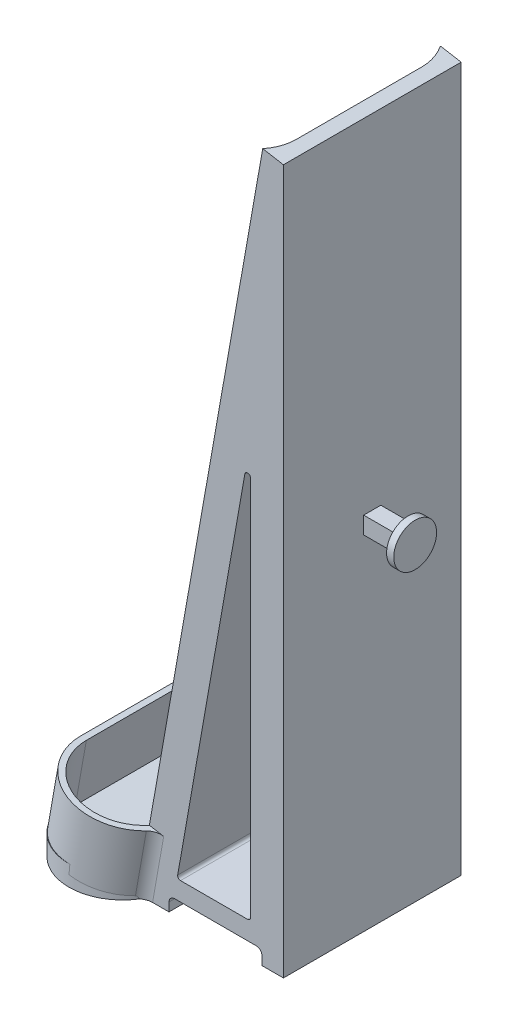
from build123d import *

# Parameters (mm, degrees)
BOSS_EXTRUDE1_DEPTH   = 3.175
BOSS_EXTRUDE2_START   = -3.175
BOSS_EXTRUDE2_DEPTH   = 11.112499999999999
BODY_MOVE_COPY2_ANGLE = 90.0000000000002
BOSS_EXTRUDE5_START   = -3.175
BOSS_EXTRUDE5_DEPTH   = 127
BOSS_EXTRUDE7_DEPTH   = 3.622257574
CUT_EXTRUDE1_START    = -11.112499999999999
CUT_EXTRUDE1_DEPTH    = 11.112499999999999
CUT_EXTRUDE4_REACH    = 131.332
LOFT1_START           = -15.77975
LOFT1_DEPTH           = 31.5595
CUT_EXTRUDE5_DEPTH    = 1.27
CUT_EXTRUDE6_DEPTH    = 133.79321580314624
FILLET2_R             = 0.508
CUT_EXTRUDE7_DEPTH    = 133.79321580314624
FILLET3_R             = 2.54
BOSS_EXTRUDE9_DEPTH   = 7.619999999999999
SKETCH20_R            = 3.81
BOSS_EXTRUDE10_DEPTH  = 1.27


with BuildPart() as part:
    # Sketch4 → Boss-Extrude1 (new body)
    with BuildSketch(Plane(origin=(0, 0, 0), x_dir=(0.984807753012208, -0.17364817766693072, 0), z_dir=(0.17364817766693072, 0.984807753012208, 0))):
        with BuildLine():
            Line((0, -8.731249999999998), (-22.225, -8.731249999999998))
            ThreePointArc((-22.225, -8.731249999999998), (-30.956249999999997, -1.63e-15), (-22.225000000000005, 8.73124999999999))
            Line((-22.225000000000005, 8.73124999999999), (1.71e-15, 8.73125))
            ThreePointArc((1.71e-15, 8.73125), (8.731249999999998, 0), (0, -8.731249999999998))
        make_face()
    extrude(amount=BOSS_EXTRUDE1_DEPTH)

    # Sketch5 → Boss-Extrude2 (add)
    with BuildSketch(Plane(origin=(0.5513329640925053, 3.1267646158137623, 0), x_dir=(0.9848077530122081, -0.17364817766693072, 0), z_dir=(0.17364817766693072, 0.9848077530122081, 0)).offset(BOSS_EXTRUDE2_START)):
        with BuildLine():
            Line((1.57e-15, 9.74725), (-22.225000000000005, 9.74724999999999))
            ThreePointArc((-22.225000000000005, 9.74724999999999), (-31.97225, -1.51e-15), (-22.225, -9.747249999999998))
            Line((-22.225, -9.747249999999998), (1.79e-15, -9.74725))
            ThreePointArc((1.79e-15, -9.74725), (9.74725, 2.16e-15), (1.57e-15, 9.74725))
        make_face()
        with BuildLine():
            Line((5.3e-16, 8.73125), (-22.225000000000005, 8.73124999999999))
            ThreePointArc((-22.225000000000005, 8.73124999999999), (-30.956249999999997, -1.63e-15), (-22.225000000000005, -8.731249999999998))
            Line((-22.225000000000005, -8.731249999999998), (-1.6e-15, -8.73125))
            ThreePointArc((-1.6e-15, -8.73125), (8.73125, -1.94e-15), (5.3e-16, 8.73125))
        make_face(mode=Mode.SUBTRACT)
    extrude(amount=BOSS_EXTRUDE2_DEPTH)


with BuildPart() as part_1:
    # Body-Move/Copy2: moved
    add(part.part.moved(Location((5e-17, 2.8e-16, 0))).rotate(Axis((-10.943676155348163, 1.9296653743237675, 1.73e-15), (0.1736481776669307, 0.984807753012208, 0)), BODY_MOVE_COPY2_ANGLE))

    # Sketch6 → Boss-Extrude5 (add)
    with BuildSketch(Plane(origin=(0.5513329640925054, 3.1267646158137636, -9e-17), x_dir=(0.9848077530122081, -0.1736481776669307, 0), z_dir=(0.1736481776669307, 0.9848077530122081, 0)).offset(BOSS_EXTRUDE5_START)):
        with BuildLine():
            Line((4.4e-16, 15.779750000000002), (-2.5553006918151486, 15.779750000000002))
            ThreePointArc((-2.5553006918151517, 15.77975), (-1.6674472336253352, 13.520790016359634), (-1.3652500000000423, 11.112500000000036))
            Line((-1.3652500000000418, 11.112500000000034), (-1.3652499999999672, -11.11250000000001))
            ThreePointArc((-1.3652499999999694, -11.112500000000013), (-1.667447233625257, -13.520790016359623), (-2.5553006918150736, -15.77975))
            Line((-2.555300691815072, -15.779750000000002), (4.49e-15, -15.779750000000002))
            Line((-1.1e-16, -15.77975), (-1.1e-16, 15.779750000000002))
        make_face()
        with BuildLine():
            ThreePointArc((-1.3652500000000423, 11.112500000000036), (-1.6674472336253352, 13.520790016359634), (-2.5553006918151517, 15.77975))
            Line((-2.5553006918151486, 15.779750000000002), (-3.733373764462396, 15.779750000000002))
            ThreePointArc((-3.7333737644623968, 15.77975), (-2.7260906817477455, 13.54208130327656), (-2.381250000000044, 11.11250000000003))
            Line((-2.3812500000000436, 11.112500000000027), (-2.381249999999966, -11.112499999999974))
            ThreePointArc((-2.3812499999999677, -11.112499999999974), (-2.7260906817476602, -13.542081303276534), (-3.7333737644623177, -15.779750000000003))
            Line((-3.7333737644623204, -15.779750000000002), (-2.555300691815072, -15.779750000000002))
            ThreePointArc((-2.5553006918150736, -15.77975), (-1.667447233625257, -13.520790016359623), (-1.3652499999999694, -11.112500000000013))
            Line((-1.3652499999999672, -11.11250000000001), (-1.3652500000000418, 11.112500000000034))
        make_face()
    extrude(amount=BOSS_EXTRUDE5_DEPTH)


with BuildPart() as boss_extrude7_tool:
    # Boss-Extrude7: read off the stored shape, not the designer's step
    # Boss-Extrude7 outline → Boss-Extrude7 (new body)
    with BuildSketch(Plane(origin=(0, 0, 0), x_dir=(1, 0, 0), z_dir=(0, 1, 0))):
        with BuildLine():
            Line((22.053318564, 15.77975), (-2.516479933, 15.77975))
            add(Edge.make_bspline(
                [(-2.516479933, 15.77975), (-6.087914144025663, 22.428833371813603), (-13.315378834961066, 20.557552766374705), (-20.54284352589647, 18.686272160935808), (-20.542843526, 11.1125)],
                knots=[2.070114834496927, 2.070114834496927, 2.070114834496927, 3.3912519074408096, 3.3912519074408096, 4.712388980384692, 4.712388980384692, 4.712388980384692], degree=2, weights=[1, 0.7896435245481747, 1, 0.7896435245481747, 1]))
            Line((-20.542843526, 11.1125), (-20.542843526, -11.1125))
            add(Edge.make_bspline(
                [(-20.542843526, -11.1125), (-20.542843525896345, -18.68627216093585), (-13.315378834960956, -20.557552766374716), (-6.08791414402557, -22.428833371813585), (-2.516479933, -15.77975)],
                knots=[4.712388980384692, 4.712388980384692, 4.712388980384692, 6.033526053328573, 6.033526053328573, 7.354663126272453, 7.354663126272453, 7.354663126272453], degree=2, weights=[1, 0.7896435245481753, 1, 0.7896435245481753, 1]))
            Line((-2.516479933, -15.77975), (22.053318564, -15.77975))
            Line((22.053318564, -15.77975), (22.053318564, 15.77975))
        make_face()
    extrude(amount=BOSS_EXTRUDE7_DEPTH)


with BuildPart() as part_2:
    add(part_1.part)


with BuildPart() as part_3:
    # Boss-Extrude7: joined with boss_extrude7_tool
    add(part_2.part.fuse(boss_extrude7_tool.part, tol=0.00001))

    # Sketch8 → Cut-Extrude1 (cut)
    with BuildSketch(Plane(origin=(1.929665374323769, 10.943676155348173, 0), x_dir=(0.9848077530122081, -0.17364817766693075, 0), z_dir=(0.17364817766693075, 0.9848077530122081, 0)).offset(CUT_EXTRUDE1_START)):
        with BuildLine():
            ThreePointArc((-3.7333737644623213, -15.779750000000003), (-3.2397646593705955, -14.88804828056871), (-2.853430222713813, -13.944900567790237))
            Line((-2.8534302227138113, -13.944900567790235), (-2.853430222713809, 13.94490056779))
            ThreePointArc((-2.8534302227138095, 13.94490056779), (-3.2397646593706177, 14.888048280568597), (-3.7333737644623985, 15.779750000000003))
            ThreePointArc((-3.7333737644623985, 15.779750000000003), (-13.542081303276605, 19.498909318252295), (-19.843750000000043, 11.112499999999972))
            Line((-19.843750000000046, 11.112499999999972), (-19.843749999999957, -11.112500000000043))
            ThreePointArc((-19.843749999999957, -11.112500000000042), (-13.54208130327649, -19.498909318252302), (-3.7333737644623213, -15.779750000000003))
        make_face()
    extrude(amount=CUT_EXTRUDE1_DEPTH, mode=Mode.SUBTRACT)

    # Sketch9 → Cut-Extrude4 (cut, up to next)
    with BuildSketch(Plane(origin=(0, 0, 0), x_dir=(0.9848077530122081, -0.17364817766693072, 0), z_dir=(0.17364817766693072, 0.9848077530122081, 0)), mode=Mode.PRIVATE) as cut_extrude4_sk1:
        with BuildLine():
            Line((-2.3812500000174737, -11.112499999999976), (-2.3812500000295542, 11.112500000000031))
            ThreePointArc((-2.3812500000295542, 11.112500000000031), (-2.500104004853256, 12.54824433126907), (-2.853430222713811, 13.944900567789999))
            Line((-2.853430222713811, 13.944900567789999), (-2.8534302227138113, -13.944900567790238))
            ThreePointArc((-2.8534302227138113, -13.944900567790238), (-2.500104004825662, -12.548244331273757), (-2.3812500000174737, -11.112499999999976))
        make_face()
    cut_extrude4_tool1 = extrude(cut_extrude4_sk1.sketch, amount=CUT_EXTRUDE4_REACH, mode=Mode.PRIVATE) & part_3.part
    add(cut_extrude4_tool1.solids().sort_by_distance((-2.584299, 0.455682, 0))[0], mode=Mode.SUBTRACT)

    # Loft1: read off the stored shape, not the designer's step
    # Loft1 outline → Loft1 (add)
    with BuildSketch(Plane.XY.offset(LOFT1_START)):
        Polygon((0.638701741, 3.622257574), (22.053318564, 3.622257574), (22.053318564, 125.070584633), align=None)
    extrude(amount=LOFT1_DEPTH)

    # Sketch12 → Cut-Extrude5 (cut)
    with BuildSketch(Plane(origin=(-2.345073461860326, 0.4134997230693797, 8.13e-15), x_dir=(3.36e-15, -5.9e-16, 1), z_dir=(-0.9848077530122081, 0.17364817766693072, 3.4134285390241548e-15))):
        Polygon((-4.240460714922467, 114.34300132888832), (-2.4689363790337167, 114.34300132888832), (-2.4689363790337167, 100.60010241642621), (4.856262408628966, 100.60010241642621), (4.856262408628966, 99.04050890599655), (-4.240460714922467, 99.04050890599655), align=None)
    extrude(amount=-CUT_EXTRUDE5_DEPTH, mode=Mode.SUBTRACT)

    # Sketch13 → Cut-Extrude6 (cut, through all)
    with BuildSketch(Plane(origin=(-8e-17, -4.3e-16, -15.779750000000002), x_dir=(-1, 0, 0), z_dir=(0, -3e-17, -1))):
        Polygon((-5.020709493215531, 16.330763945263843), (-3.171257415384888, 5.842), (-4.367504164096216, 5.842), (-16.211318563640102, 5.842), (-16.211318563640102, 79.79586171686451), align=None)
    extrude(amount=-CUT_EXTRUDE6_DEPTH, mode=Mode.SUBTRACT)

    # Fillet2
    fillet2_edges = [part_3.edges().sort_by_distance(p)[0] for p in [
        (3.171257415384888, 5.842, -1.78e-15),
        (16.211318563640102, 5.842, -1.78e-15),
        (16.211318563640102, 79.79586171686451, -1.78e-15),
    ]]
    fillet(fillet2_edges, radius=FILLET2_R)

    # Sketch15 → Cut-Extrude7 (cut, through all)
    with BuildSketch(Plane.XY.offset(15.779750000000002)):
        with BuildLine():
            Line((18.243318563640102, -4.3e-16), (1.733318563640101, -2.45e-15))
            Line((1.733318563640101, -2.45e-15), (1.733318563640101, 1.5239999999999905))
            ThreePointArc((1.733318563640101, 1.5239999999999905), (2.0308980739545683, 2.24242048968553), (2.7493185636401076, 2.5399999999999974))
            Line((2.7493185636401076, 2.5399999999999974), (17.227318563640093, 2.5399999999999996))
            ThreePointArc((17.227318563640093, 2.5399999999999996), (17.945739053325635, 2.242420489685533), (18.243318563640102, 1.5239999999999927))
            Line((18.243318563640102, 1.5239999999999927), (18.243318563640102, -4.3e-16))
        make_face()
    extrude(amount=-CUT_EXTRUDE7_DEPTH, mode=Mode.SUBTRACT)

    # Fillet3
    fillet3_edges = [part_3.edges().sort_by_distance(p)[0] for p in [
        (-1.5516472454151984, 5.915561386198842, -15.779750000000057),
        (-1.5516472454151131, 5.915561386198828, 15.779750000000059),
    ]]
    fillet(fillet3_edges, radius=FILLET3_R)

    # Sketch18 → Boss-Extrude9 (add)
    with BuildSketch(Plane(origin=(22.0533185636401, 0, 0), x_dir=(0, 0, -1), z_dir=(1, 0, 0))):
        Polygon((-1.5240000000000167, 64.05929231628052), (1.5239999999999834, 64.05929231628052), (1.5239999999999836, 61.01129231628052), (-1.5240000000000162, 61.01129231628052), align=None)
    extrude(amount=BOSS_EXTRUDE9_DEPTH)

    # Sketch20 → Boss-Extrude10 (add)
    with BuildSketch(Plane(origin=(29.673318563640102, 0, 0), x_dir=(0, 0, -1), z_dir=(1, 0, 0))):
        with Locations((2.2e-16, 62.53529231628052)):
            Circle(SKETCH20_R)
        Polygon((1.5239999999999836, 61.01129231628052), (1.5239999999999834, 64.05929231628052), (-1.5240000000000167, 64.05929231628052), (-1.5240000000000162, 61.01129231628052), align=None, mode=Mode.SUBTRACT)
    extrude(amount=-BOSS_EXTRUDE10_DEPTH)


solid = part_3.part
